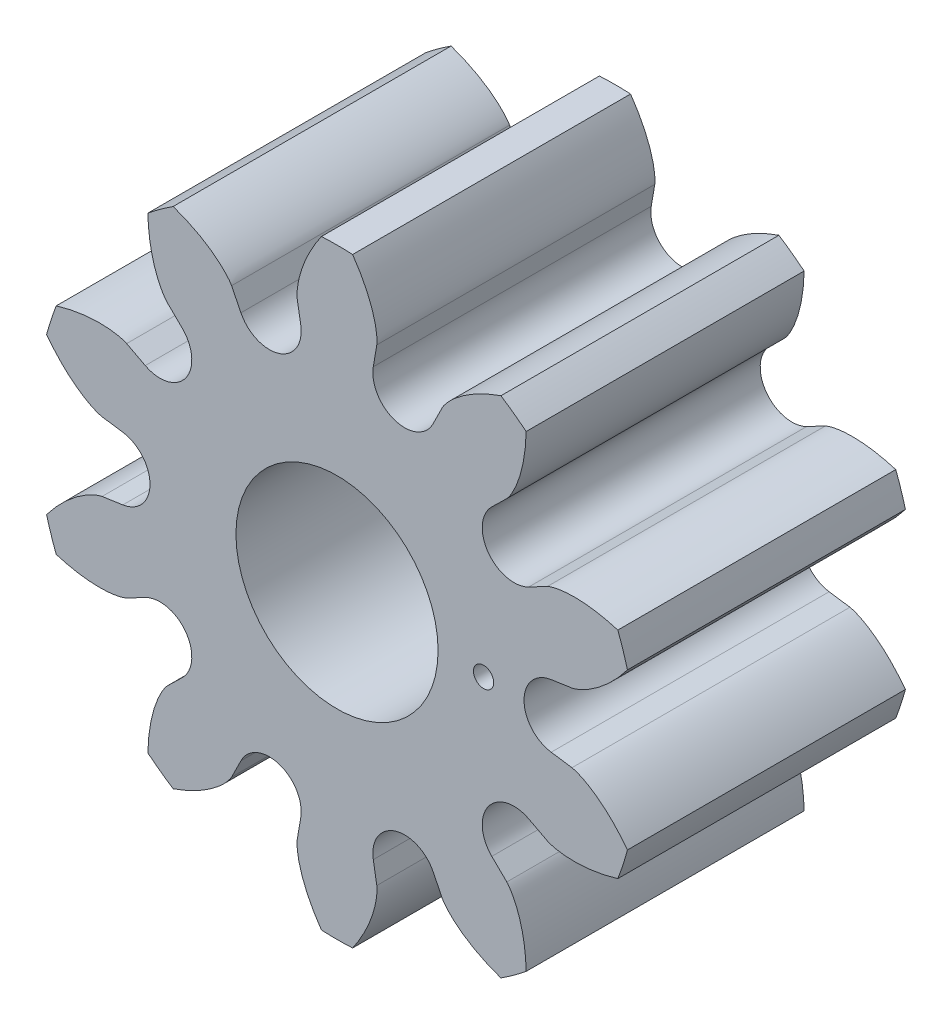
from build123d import *

# Parameters (mm, degrees)
SKETCH2_R               = 2.975
BOSS_EXTRUDE1_DEPTH     = 2.75
CUT_EXTRUDE2_DEPTH      = 6.0263058
CIRPATTERN1_COUNT       = 10
SKETCH3_R               = 1
CUT_EXTRUDE3_DEPTH      = 5.966777819
CUT_EXTRUDE5_DEPTH      = 5.966777819
CUT_EXTRUDE5_DEPTH_BACK = 5.966777819
SKETCH7_R               = 0.1


with BuildPart() as part:
    # Sketch2 → Boss-Extrude1 (new body)
    with BuildSketch(Plane.XY):
        Circle(SKETCH2_R)
    extrude(amount=BOSS_EXTRUDE1_DEPTH)

    # Sketch1 → Cut-Extrude2 (cut, through all)
    with BuildSketch(Plane.XY):
        with BuildLine():
            Line((2.118802744, 0.311161557), (2.324301091, 0.34134048))
            add(Edge.make_bspline(
                [(2.324301091, 0.34134048), (2.327204258, 0.341815705), (2.332645888, 0.342990352), (2.341463124, 0.345203683), (2.358685029, 0.350326563), (2.377879698, 0.357141289), (2.399256445, 0.365837608), (2.421899485, 0.376172847), (2.441040441, 0.385618346), (2.459919009, 0.395602125), (2.478523013, 0.406050721), (2.50080724, 0.41929552), (2.527170856, 0.435991488), (2.557432856, 0.45667418), (2.591076949, 0.481496158), (2.624597297, 0.508223583), (2.656935123, 0.535689473), (2.68882409, 0.564749178), (2.71911952, 0.593792108), (2.749735115, 0.625259349), (2.777564749, 0.654970642), (2.807756809, 0.689656812), (2.831837429, 0.718061283), (2.855861, 0.748540952), (2.867426399, 0.763542025), (2.873282998, 0.771278038)],
                knots=[0, 0, 0, 0, 0, 0.015083688, 0.02853182, 0.046610139, 0.092110525, 0.119476176, 0.146842496, 0.174208854, 0.201574956, 0.228941013, 0.256307345, 0.307035032, 0.361767352, 0.416499661, 0.471231936, 0.525964282, 0.580696615, 0.635428982, 0.690161387, 0.744893688, 0.799626082, 0.854358408, 0.909090915, 0.909090915, 0.909090915, 0.909090915, 0.909090915], degree=4))
            ThreePointArc((2.873282998, 0.771278038), (2.975, 0), (2.873282998, -0.771278038))
            add(Edge.make_bspline(
                [(2.324301091, -0.34134048), (2.327204258, -0.341815705), (2.332645888, -0.342990352), (2.341463124, -0.345203683), (2.358685029, -0.350326563), (2.377879698, -0.357141289), (2.399256445, -0.365837608), (2.421899485, -0.376172847), (2.441040441, -0.385618346), (2.459919009, -0.395602125), (2.478523013, -0.406050721), (2.50080724, -0.41929552), (2.527170856, -0.435991488), (2.557432856, -0.45667418), (2.591076949, -0.481496158), (2.624597297, -0.508223583), (2.656935123, -0.535689473), (2.68882409, -0.564749178), (2.71911952, -0.593792108), (2.749735115, -0.625259349), (2.777564749, -0.654970642), (2.807756809, -0.689656812), (2.831837429, -0.718061283), (2.855861, -0.748540952), (2.867426399, -0.763542025), (2.873282998, -0.771278038)],
                knots=[0, 0, 0, 0, 0, 0.015083688, 0.02853182, 0.046610139, 0.092110525, 0.119476176, 0.146842496, 0.174208854, 0.201574956, 0.228941013, 0.256307345, 0.307035032, 0.361767352, 0.416499661, 0.471231936, 0.525964282, 0.580696615, 0.635428982, 0.690161387, 0.744893688, 0.799626082, 0.854358408, 0.909090915, 0.909090915, 0.909090915, 0.909090915, 0.909090915], degree=4))
            Line((2.324301091, -0.34134048), (2.118802744, -0.311161557))
            ThreePointArc((2.118802744, -0.311161557), (1.9265063, -0.205594522), (1.85, 0))
            ThreePointArc((1.85, 0), (1.9265063, 0.205594522), (2.118802744, 0.311161557))
        make_face()
    cut_extrude2 = extrude(amount=CUT_EXTRUDE2_DEPTH, mode=Mode.SUBTRACT)

    # CirPattern1: Cut-Extrude2 ×10 about axis
    cirpattern1_axis = Axis((0, 0, 4.582847529), (0, 0, -1))
    for i in range(1, CIRPATTERN1_COUNT):
        add(cut_extrude2.rotate(cirpattern1_axis, i * 360 / CIRPATTERN1_COUNT), mode=Mode.SUBTRACT)

    # Sketch3 → Cut-Extrude3 (cut, through all)
    with BuildSketch(Plane.XY):
        Circle(SKETCH3_R)
    extrude(amount=CUT_EXTRUDE3_DEPTH, mode=Mode.SUBTRACT)

    # Sketch7 → Cut-Extrude5 (cut, two sides: drawn at the far end of the back side and taken through both)
    with BuildSketch(Plane.XY.offset(-CUT_EXTRUDE5_DEPTH_BACK)):
        with Locations((1.45, 0)):
            Circle(SKETCH7_R)
    extrude(amount=CUT_EXTRUDE5_DEPTH + CUT_EXTRUDE5_DEPTH_BACK, mode=Mode.SUBTRACT)


solid = part.part
